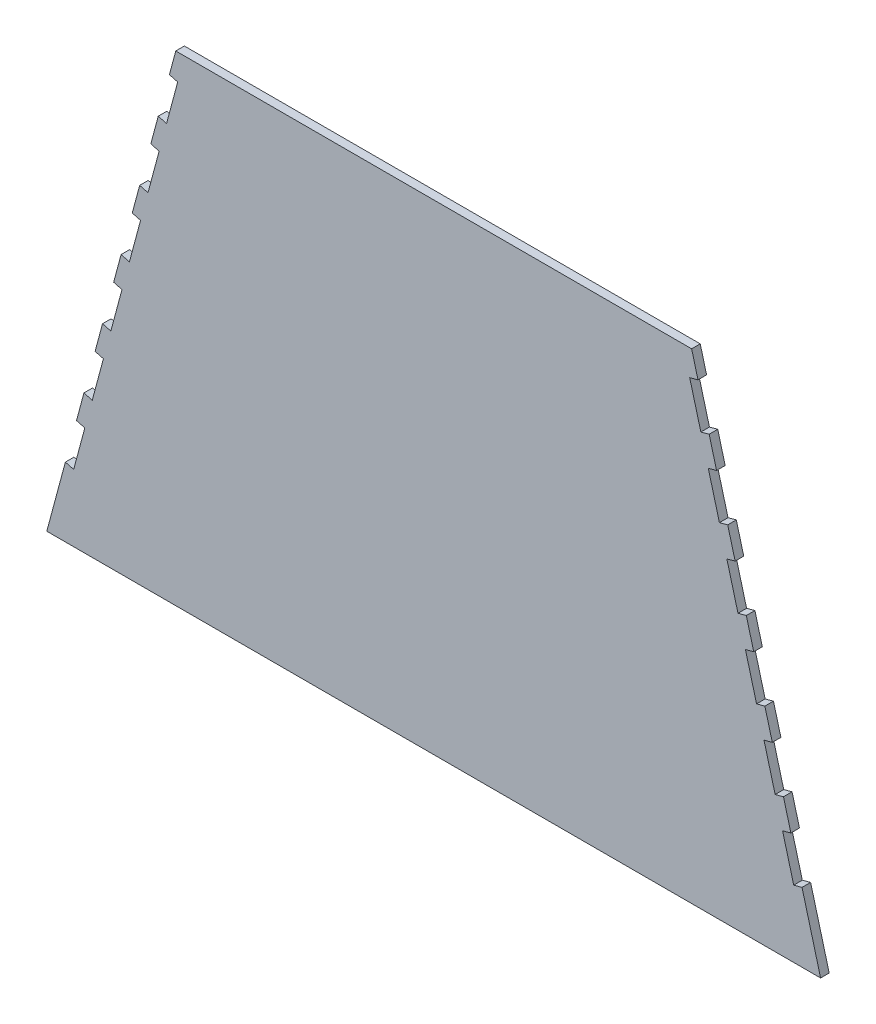
from build123d import *

# Parameters (mm, degrees)
BOSS_EXTRUDE1_DEPTH = 3
CUT_EXTRUDE2_DEPTH  = 3
LPATTERN2_COUNT     = 6
LPATTERN2_PITCH     = 25
CUT_EXTRUDE3_DEPTH  = 3
LPATTERN3_COUNT     = 6
LPATTERN3_PITCH     = 25


with BuildPart() as part:
    # Sketch1 → Boss-Extrude1 (new body)
    with BuildSketch(Plane.XY):
        Polygon((-135, -83.815273071), (135, -83.815273071), (90, 83.815273071), (-90, 83.815273071), align=None)
    extrude(amount=BOSS_EXTRUDE1_DEPTH)

    # Sketch2 → Cut-Extrude2 (cut)
    with BuildSketch(Plane.XY.offset(3)):
        Polygon((-128.518298978, -59.670137912), (-125.620882759, -60.447942034), (-121.731862146, -45.960860939), (-124.629278366, -45.183056816), align=None)
    cut_extrude2 = extrude(amount=-CUT_EXTRUDE2_DEPTH, mode=Mode.SUBTRACT)

    # LPattern2: Cut-Extrude2 ×6
    with Locations(*[Vector(0.2592680408620549, 0.9658054063772639, 0) * (i * LPATTERN2_PITCH) for i in range(1, LPATTERN2_COUNT)]):
        add(cut_extrude2, mode=Mode.SUBTRACT)

    # Sketch3 → Cut-Extrude3 (cut)
    with BuildSketch(Plane.XY.offset(3)):
        Polygon((128.518298978, -59.670137912), (124.629278366, -45.183056816), (121.731862146, -45.960860939), (125.620882759, -60.447942034), align=None)
    cut_extrude3 = extrude(amount=-CUT_EXTRUDE3_DEPTH, mode=Mode.SUBTRACT)

    # LPattern3: Cut-Extrude3 ×6
    with Locations(*[Vector(-0.2592680408620553, 0.9658054063772639, 0) * (i * LPATTERN3_PITCH) for i in range(1, LPATTERN3_COUNT)]):
        add(cut_extrude3, mode=Mode.SUBTRACT)


solid = part.part
